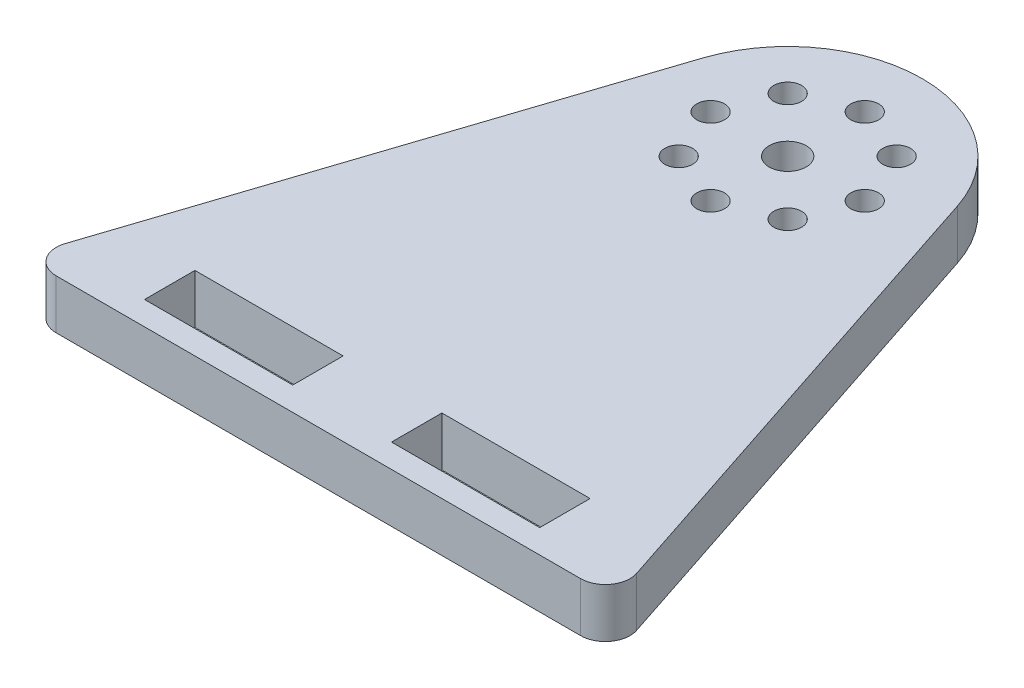
from build123d import *

# Parameters (mm, degrees)
SKETCH1_R           = 2.38125
SKETCH1_R_2         = 1.7859375
SKETCH1_W           = 19.05
SKETCH1_H           = 6.477
BOSS_EXTRUDE1_DEPTH = 6.35
FILLET1_R           = 3.175


with BuildPart() as part:
    # Sketch1 → Boss-Extrude1 (new body)
    with BuildSketch(Plane(origin=(0, 0, 0), x_dir=(1, 0, 0), z_dir=(0, 1, 0))):
        with BuildLine():
            Line((-38.1, -60.325), (38.1, -60.325))
            Line((38.1, -60.325), (16.434596974, 5.41612523))
            ThreePointArc((16.434596974, 5.41612523), (0, 17.304057045), (-16.434596974, 5.41612523))
            Line((-16.434596974, 5.41612523), (-38.1, -60.325))
        make_face()
        Circle(SKETCH1_R, mode=Mode.SUBTRACT)
        with Locations((-9.906, 0)):
            Circle(SKETCH1_R_2, mode=Mode.SUBTRACT)
        with Locations((-7.004599774, 7.004599774)):
            Circle(SKETCH1_R_2, mode=Mode.SUBTRACT)
        with Locations((0, 9.906)):
            Circle(SKETCH1_R_2, mode=Mode.SUBTRACT)
        with Locations((7.004599774, 7.004599774)):
            Circle(SKETCH1_R_2, mode=Mode.SUBTRACT)
        with Locations((9.906, 0)):
            Circle(SKETCH1_R_2, mode=Mode.SUBTRACT)
        with Locations((7.004599774, -7.004599774)):
            Circle(SKETCH1_R_2, mode=Mode.SUBTRACT)
        with Locations((0, -9.906)):
            Circle(SKETCH1_R_2, mode=Mode.SUBTRACT)
        with Locations((-7.004599774, -7.004599774)):
            Circle(SKETCH1_R_2, mode=Mode.SUBTRACT)
        with Locations((15.875, -54.0385)):
            Rectangle(SKETCH1_W, SKETCH1_H, mode=Mode.SUBTRACT)
        with Locations((-15.875, -54.0385)):
            Rectangle(SKETCH1_W, SKETCH1_H, mode=Mode.SUBTRACT)
    extrude(amount=BOSS_EXTRUDE1_DEPTH)

    # Fillet1
    fillet1_edges = [part.edges().sort_by_distance(p)[0] for p in [
        (38.1, 3.175, 60.325),
        (-38.1, 3.175, 60.325),
    ]]
    fillet(fillet1_edges, radius=FILLET1_R)


solid = part.part
